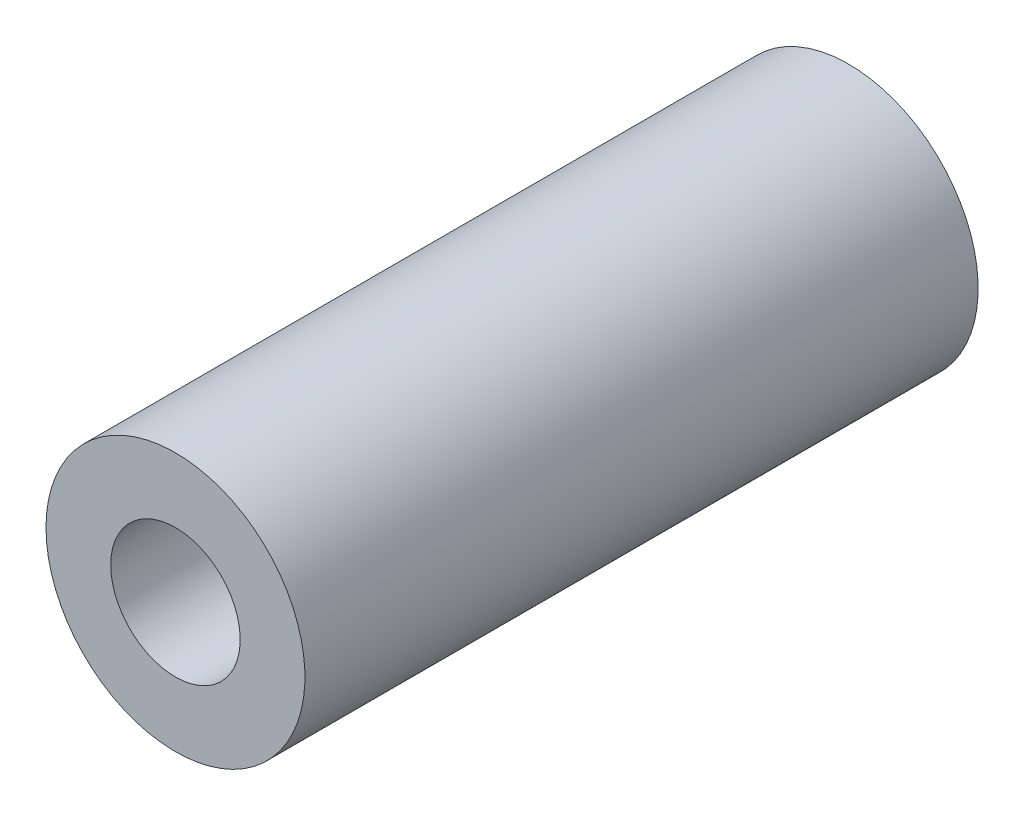
from build123d import *

# Parameters (mm, degrees)
SKETCH1_R           = 5
SKETCH1_R_2         = 2.5
BOSS_EXTRUDE1_DEPTH = 26


with BuildPart() as part:
    # Sketch1 → Boss-Extrude1 (new body)
    with BuildSketch(Plane.XY):
        Circle(SKETCH1_R)
        Circle(SKETCH1_R_2, mode=Mode.SUBTRACT)
    extrude(amount=BOSS_EXTRUDE1_DEPTH)


solid = part.part
